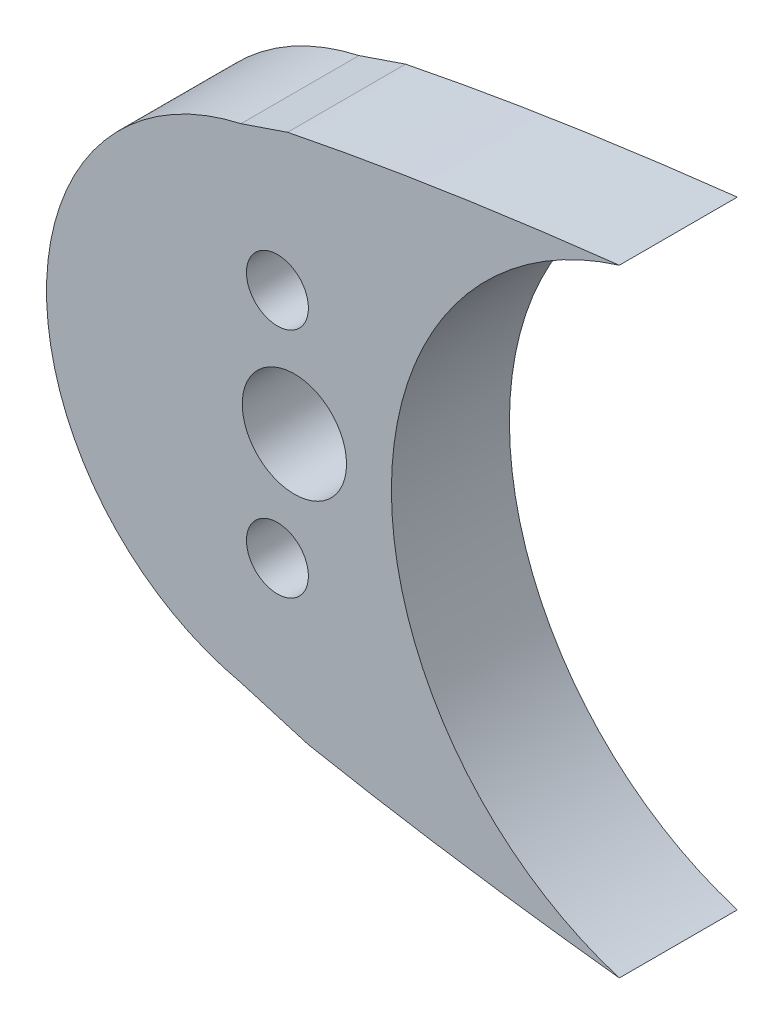
from build123d import *

# Parameters (mm, degrees)
BOSS_EXTRUDE1_START     = 4.25
BOSS_EXTRUDE1_OUTLINE_R = 2.65
BOSS_EXTRUDE1_DEPTH     = 6
CUT_EXTRUDE2_DEPTH      = 49.147003594
CUT_EXTRUDE3_DEPTH      = 46.050777478


# Read off the part's stored shape, not the designer's step: Boss-Extrude1
with BuildPart() as part:
    # Boss-Extrude1 outline → Boss-Extrude1 (new body)
    with BuildSketch(Plane.XY.offset(BOSS_EXTRUDE1_START)):
        with BuildLine():
            ThreePointArc((22.5, 12.599580353), (12.378691282, 0), (22.5, -12.599580353))
            add(Edge.make_bspline(
                [(22.5, -12.599580353), (24.539912926, -13.049943774), (29.005619164, -13.923317691), (36.155474951, -15.030554758), (41.619048326, -15.685620583), (44.644632939, -15.999223801), (45, -16.035396523)],
                knots=[0.544361959, 0.544361959, 0.544361959, 0.544361959, 0.554606397, 0.566671735, 0.579837557, 0.581589368, 0.581589368, 0.581589368, 0.581589368], degree=3))
            ThreePointArc((45, -16.035396523), (30.513983858, 0), (45, 16.035396523))
            add(Edge.make_bspline(
                [(45, 16.035396523), (44.644632939, 15.999223801), (41.619048326, 15.685620583), (36.155474951, 15.030554758), (29.005619164, 13.923317691), (24.539912926, 13.049943774), (22.5, 12.599580353)],
                knots=[0.418410632, 0.418410632, 0.418410632, 0.418410632, 0.420162443, 0.433328265, 0.445393603, 0.455638041, 0.455638041, 0.455638041, 0.455638041], degree=3))
        make_face()
        with Locations((25.281682512, 0)):
            Circle(BOSS_EXTRUDE1_OUTLINE_R, mode=Mode.SUBTRACT)
    extrude(amount=BOSS_EXTRUDE1_DEPTH)

    # Sketch3 → Cut-Extrude2 (cut, through all)
    with BuildSketch(Plane.XY.offset(10.25)):
        with BuildLine():
            ThreePointArc((22.564675294, -12.306634784), (12.678691282, 0), (22.564675294, 12.306634784))
            Line((22.564675294, 12.306634784), (24.936220162, 13.113775399))
            add(Edge.make_bspline(
                [(24.936220162, 13.113775399), (24.122635067, 12.949661044), (23.310473255, 12.77851324), (22.5, 12.599580353)],
                knots=[0.451567846, 0.451567846, 0.451567846, 0.451567846, 0.455638041, 0.455638041, 0.455638041, 0.455638041], degree=3))
            ThreePointArc((22.5, 12.599580353), (12.378691282, 0), (22.5, -12.599580353))
            add(Edge.make_bspline(
                [(22.5, -12.599580353), (23.661751431, -12.856066962), (24.826972348, -13.096557541), (25.994881444, -13.323265839)],
                knots=[0.544361959, 0.544361959, 0.544361959, 0.544361959, 0.550196272, 0.550196272, 0.550196272, 0.550196272], degree=3))
            Line((25.994881444, -13.323265839), (22.564675294, -12.306634784))
        make_face()
        with BuildLine():
            add(Edge.make_bspline(
                [(45, 16.035396523), (44.644632939, 15.999223801), (43.577975433, 15.888664266), (42.511942906, 15.772070236), (41.801329262, 15.691443866)],
                knots=[0.418410632, 0.418410632, 0.418410632, 0.418410632, 0.420162443, 0.423669783, 0.423669783, 0.423669783, 0.423669783], degree=3))
            ThreePointArc((41.801329262, 15.691443866), (30.213983858, 0), (41.801329262, -15.691443866))
            add(Edge.make_bspline(
                [(41.801329262, -15.691443866), (42.511942906, -15.772070236), (43.577975433, -15.888664266), (44.644632939, -15.999223801), (45, -16.035396523)],
                knots=[0.576330217, 0.576330217, 0.576330217, 0.576330217, 0.579837557, 0.581589368, 0.581589368, 0.581589368, 0.581589368], degree=3))
            ThreePointArc((45, -16.035396523), (30.513983858, 0), (45, 16.035396523))
        make_face()
    extrude(amount=-CUT_EXTRUDE2_DEPTH, mode=Mode.SUBTRACT)

    # Sketch4 → Cut-Extrude3 (cut, through all)
    with BuildSketch(Plane.XY.offset(10.25)):
        with BuildLine():
            ThreePointArc((25.993828758, 5.9), (25.532521939, 7.01369318), (24.418828758, 7.475))
            Line((24.418828758, 7.475), (24.418828758, 4.325))
            ThreePointArc((24.418828758, 4.325), (25.532521939, 4.78630682), (25.993828758, 5.9))
        make_face()
        with BuildLine():
            Line((24.418828758, 4.325), (24.418828758, 7.475))
            ThreePointArc((24.418828758, 7.475), (22.843828758, 5.9), (24.418828758, 4.325))
        make_face()
        with BuildLine():
            ThreePointArc((25.993828758, -5.9), (25.532521939, -4.78630682), (24.418828758, -4.325))
            Line((24.418828758, -4.325), (24.418828758, -7.475))
            ThreePointArc((24.418828758, -7.475), (25.532521939, -7.01369318), (25.993828758, -5.9))
        make_face()
        with BuildLine():
            Line((24.418828758, -7.475), (24.418828758, -4.325))
            ThreePointArc((24.418828758, -4.325), (22.843828758, -5.9), (24.418828758, -7.475))
        make_face()
    extrude(amount=-CUT_EXTRUDE3_DEPTH, mode=Mode.SUBTRACT)


solid = part.part
